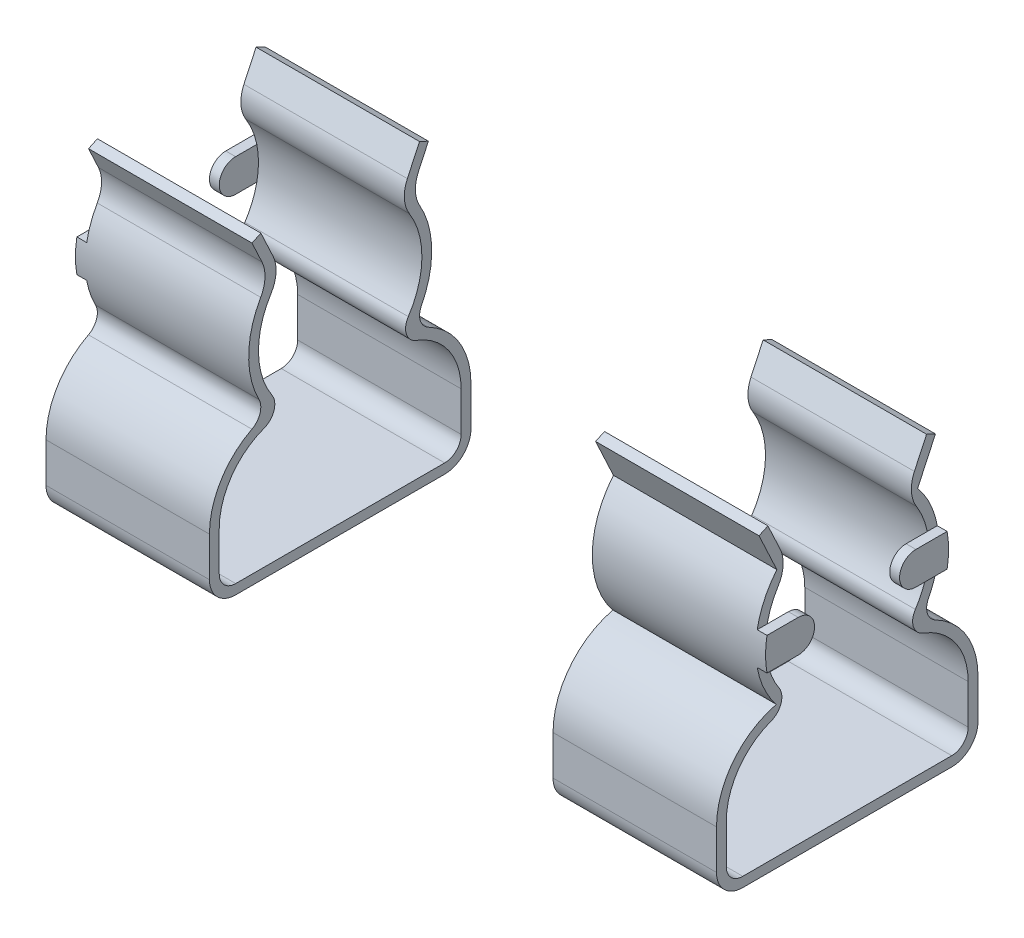
from build123d import *
from build123d.topology import SkipClean

# Parameters (mm, degrees)
CUT_EXTRUDE1_START       = -16.646
CUT_EXTRUDE1_OUTLINE_W   = 5.494349208
CUT_EXTRUDE1_OUTLINE_H   = 1.206951679
CUT_EXTRUDE1_DEPTH       = 22.78
CUT_EXTRUDE1_2_DEPTH     = 6.134
CUT_EXTRUDE1_3_DEPTH     = 6.134
CUT_EXTRUDE1_START_2     = -16.506
CUT_EXTRUDE1_4_DEPTH     = 0.001862507
CUT_EXTRUDE1_START_3     = 5.992137493
CUT_EXTRUDE1_5_DEPTH     = 0.001862507
CUT_EXTRUDE1_START_4     = -3.196
CUT_EXTRUDE1_6_OUTLINE_W = 0.14
CUT_EXTRUDE1_6_OUTLINE_H = 1.8
CUT_EXTRUDE1_6_DEPTH     = 6.392
CUT_EXTRUDE1_START_5     = -0.55
CUT_EXTRUDE1_7_DEPTH     = 1.1
CUT_EXTRUDE1_START_6     = -11.39
CUT_EXTRUDE1_8_DEPTH     = 22.78
SKETCH3_W                = 10.512
SKETCH3_H                = 1.206951679
CUT_EXTRUDE2_DEPTH       = 5.194349208
SKETCH4_W                = 10.512
SKETCH4_H                = 1.206951679
CUT_EXTRUDE3_DEPTH       = 0.3
CUT_EXTRUDE4_DEPTH       = 2.196
CUT_EXTRUDE5_DEPTH       = 2.196
CUT_EXTRUDE6_DEPTH       = 2.196
CUT_EXTRUDE7_DEPTH       = 2.196
CUT_EXTRUDE8_DEPTH       = 0.420665928
CUT_EXTRUDE9_DEPTH       = 0.420665928
CUT_EXTRUDE10_DEPTH      = 0.420665928
CUT_EXTRUDE11_DEPTH      = 0.420665928
BOSS_EXTRUDE7_DEPTH      = 1.291387254
BOSS_EXTRUDE8_DEPTH      = 1.291387254
BOSS_EXTRUDE9_DEPTH      = 1.291387254
BOSS_EXTRUDE10_DEPTH     = 1.291387254
CUT_EXTRUDE13_DEPTH      = 1.710951679
CUT_EXTRUDE14_DEPTH      = 1.710951679
CUT_EXTRUDE15_DEPTH      = 0.713334072
CUT_EXTRUDE16_DEPTH      = 0.713334072
BOSS_EXTRUDE13_DEPTH     = 0.3
BOSS_EXTRUDE14_DEPTH     = 0.3
BOSS_EXTRUDE15_DEPTH     = 0.3
BOSS_EXTRUDE16_DEPTH     = 0.3
DRAFT1_ANGLE             = -3.814074834
DRAFT2_START             = -1
DRAFT2_DEPTH             = 2
DRAFT2_START_2           = -0.55
DRAFT2_2_DEPTH           = 1.1
FILLET1_R                = 0.504
FILLET2_R                = 0.504
FILLET4_R                = 1
FILLET5_R                = 1
FILLET6_R                = 0.504
FILLET7_R                = 1
CUT_EXTRUDE21_START      = -6.1
SKETCH41_W               = 3
SKETCH41_H               = 2
CUT_EXTRUDE21_DEPTH      = 6.1


with BuildPart() as part:
    # Cut-Extrude1: read off the stored shape, not the designer's step
    # Cut-Extrude1 outline → Cut-Extrude1 (new body)
    with BuildSketch(Plane(origin=(5.256, 0, 0), x_dir=(0, 0, -1), z_dir=(1, 0, 0)).offset(CUT_EXTRUDE1_START)):
        with Locations((1.252825396, 3.20747584)):
            Rectangle(CUT_EXTRUDE1_OUTLINE_W, CUT_EXTRUDE1_OUTLINE_H)
    extrude(amount=CUT_EXTRUDE1_DEPTH)

    # Cut-Extrude1 2 outline → Cut-Extrude1 2 (add)
    with BuildSketch(Plane(origin=(5.256, 0, 0), x_dir=(0, 0, -1), z_dir=(1, 0, 0)).offset(CUT_EXTRUDE1_START)):
        with BuildLine():
            Line((3.7, 3.810951679), (4, 3.810951679))
            ThreePointArc((4, 3.810951679), (3.487694935, 5.293047436), (2.169493473, 6.142405557))
            ThreePointArc((2.169493473, 6.142405557), (2.799969455, 7.925596675), (2.152862757, 9.702820197))
            Line((2.152862757, 9.702820197), (1.880970421, 9.829605676))
            Line((1.880970421, 9.829605676), (1.797323966, 9.650225274))
            ThreePointArc((1.797323966, 9.650225274), (2.491845413, 7.710759639), (1.494349208, 5.908292355))
            ThreePointArc((1.494349208, 5.908292355), (3.047089033, 5.332770766), (3.7, 3.810951679))
        make_face()
        with BuildLine():
            ThreePointArc((3.196, 1.8), (3.764513852, 2.035486148), (4, 2.604))
            Line((4, 2.604), (-1.494349208, 2.604))
            Line((-1.494349208, 2.604), (-1.494349208, 3.810951679))
            Line((-1.494349208, 3.810951679), (-3.7, 3.810951679))
            ThreePointArc((-3.7, 3.810951679), (-3.047089033, 5.332770766), (-1.494349208, 5.908292355))
            ThreePointArc((-1.494349208, 5.908292355), (-2.491845413, 7.710759639), (-1.797323966, 9.650225274))
            Line((-1.797323966, 9.650225274), (-1.880970421, 9.829605676))
            Line((-1.880970421, 9.829605676), (-2.152862757, 9.702820197))
            ThreePointArc((-2.152862757, 9.702820197), (-2.799969455, 7.925596675), (-2.169493473, 6.142405557))
            ThreePointArc((-2.169493473, 6.142405557), (-3.487694935, 5.293047436), (-4, 3.810951679))
            Line((-4, 3.810951679), (-4, 2.604))
            ThreePointArc((-4, 2.604), (-3.764513852, 2.035486148), (-3.196, 1.8))
            Line((-3.196, 1.8), (3.196, 1.8))
        make_face()
    extrude(amount=CUT_EXTRUDE1_2_DEPTH)

    # Cut-Extrude1 3 outline → Cut-Extrude1 3 (add)
    with BuildSketch(Plane(origin=(5.256, 0, 0), x_dir=(0, 0, -1), z_dir=(1, 0, 0))):
        with BuildLine():
            Line((3.7, 3.810951679), (4, 3.810951679))
            ThreePointArc((4, 3.810951679), (3.487694935, 5.293047436), (2.169493473, 6.142405557))
            ThreePointArc((2.169493473, 6.142405557), (2.799969455, 7.925596675), (2.152862757, 9.702820197))
            Line((2.152862757, 9.702820197), (1.880970421, 9.829605676))
            Line((1.880970421, 9.829605676), (1.797323966, 9.650225274))
            ThreePointArc((1.797323966, 9.650225274), (2.491845413, 7.710759639), (1.494349208, 5.908292355))
            ThreePointArc((1.494349208, 5.908292355), (3.047089033, 5.332770766), (3.7, 3.810951679))
        make_face()
        with BuildLine():
            ThreePointArc((3.196, 1.8), (3.764513852, 2.035486148), (4, 2.604))
            Line((4, 2.604), (-1.494349208, 2.604))
            Line((-1.494349208, 2.604), (-1.494349208, 3.810951679))
            Line((-1.494349208, 3.810951679), (-3.7, 3.810951679))
            ThreePointArc((-3.7, 3.810951679), (-3.047089033, 5.332770766), (-1.494349208, 5.908292355))
            ThreePointArc((-1.494349208, 5.908292355), (-2.491845413, 7.710759639), (-1.797323966, 9.650225274))
            Line((-1.797323966, 9.650225274), (-1.880970421, 9.829605676))
            Line((-1.880970421, 9.829605676), (-2.152862757, 9.702820197))
            ThreePointArc((-2.152862757, 9.702820197), (-2.799969455, 7.925596675), (-2.169493473, 6.142405557))
            ThreePointArc((-2.169493473, 6.142405557), (-3.487694935, 5.293047436), (-4, 3.810951679))
            Line((-4, 3.810951679), (-4, 2.604))
            ThreePointArc((-4, 2.604), (-3.764513852, 2.035486148), (-3.196, 1.8))
            Line((-3.196, 1.8), (3.196, 1.8))
        make_face()
    extrude(amount=CUT_EXTRUDE1_3_DEPTH)

    # Cut-Extrude1 4 outline → Cut-Extrude1 4 (add)
    with BuildSketch(Plane(origin=(5.256, 0, 0), x_dir=(0, 0, -1), z_dir=(1, 0, 0)).offset(CUT_EXTRUDE1_START_2)):
        with BuildLine():
            Line((3.196, 0), (3.196, 1.8))
            Line((3.196, 1.8), (-3.196, 1.8))
            Line((-3.196, 1.8), (-3.196, 0))
            Line((-3.196, 0), (-0.55, 0))
            Line((-0.55, 0), (-0.55, -3.45))
            ThreePointArc((-0.55, -3.45), (-0.38890873, -3.83890873), (0, -4))
            ThreePointArc((0, -4), (0.38890873, -3.83890873), (0.55, -3.45))
            Line((0.55, -3.45), (0.55, 0))
            Line((0.55, 0), (3.196, 0))
        make_face()
    extrude(amount=CUT_EXTRUDE1_4_DEPTH)

    # Cut-Extrude1 5 outline → Cut-Extrude1 5 (add)
    with BuildSketch(Plane(origin=(5.256, 0, 0), x_dir=(0, 0, -1), z_dir=(1, 0, 0)).offset(CUT_EXTRUDE1_START_3)):
        with BuildLine():
            Line((3.196, 0), (3.196, 1.8))
            Line((3.196, 1.8), (-3.196, 1.8))
            Line((-3.196, 1.8), (-3.196, 0))
            Line((-3.196, 0), (-0.55, 0))
            Line((-0.55, 0), (-0.55, -3.45))
            ThreePointArc((-0.55, -3.45), (-0.38890873, -3.83890873), (0, -4))
            ThreePointArc((0, -4), (0.38890873, -3.83890873), (0.55, -3.45))
            Line((0.55, -3.45), (0.55, 0))
            Line((0.55, 0), (3.196, 0))
        make_face()
    extrude(amount=CUT_EXTRUDE1_5_DEPTH)

    # Cut-Extrude1 6 outline → Cut-Extrude1 6 (add)
    with BuildSketch(Plane.XY.offset(CUT_EXTRUDE1_START_4)):
        with Locations((-11.32, 0.9)):
            Rectangle(CUT_EXTRUDE1_6_OUTLINE_W, CUT_EXTRUDE1_6_OUTLINE_H)
        Polygon((-11.248137493, 1.8), (-11.248137493, 0), (-11.089334072, 0), (-10.969334072, 1.8), align=None)
        with Locations((11.32, 0.9)):
            Rectangle(CUT_EXTRUDE1_6_OUTLINE_W, CUT_EXTRUDE1_6_OUTLINE_H)
        Polygon((11.089334072, 0), (11.248137493, 0), (11.248137493, 1.8), (10.969334072, 1.8), align=None)
    extrude(amount=CUT_EXTRUDE1_6_DEPTH)

    # Cut-Extrude1 7 outline → Cut-Extrude1 7 (add)
    with BuildSketch(Plane.XY.offset(CUT_EXTRUDE1_START_5)):
        Polygon((-11.25, 0), (-11.39, 0), (-11.39, -3.253333333), (-11.25, -4), align=None)
        Polygon((-11.089334072, 0), (-11.248137493, 0), (-11.248137493, -2.38205131), align=None)
        Polygon((-11.248137493, -2.38205131), (-11.248137493, -3.99965078), (-10.955138344, -3.944713439), align=None)
        Polygon((11.25, -4), (11.39, -3.253333333), (11.39, 0), (11.25, 0), align=None)
        Polygon((10.955138344, -3.944713439), (11.248137493, -3.99965078), (11.248137493, -2.38205131), align=None)
        Polygon((11.248137493, -2.38205131), (11.248137493, 0), (11.089334072, 0), align=None)
    extrude(amount=CUT_EXTRUDE1_7_DEPTH)

    # Cut-Extrude1 8 outline → Cut-Extrude1 8 (cut)
    with SkipClean():  # the faces are left unmerged after this step: merging them gives an invalid solid
        with BuildSketch(Plane.YZ.offset(CUT_EXTRUDE1_START_6)):
            with BuildLine():
                ThreePointArc((-4, 0), (-3.83890873, 0.38890873), (-3.45, 0.55))
                Line((-3.45, 0.55), (-2, 0.55))
                Line((-2, 0.55), (-2, 2))
                Line((-2, 2), (-5, 2))
                Line((-5, 2), (-5, -2))
                Line((-5, -2), (-2, -2))
                Line((-2, -2), (-2, -0.55))
                Line((-2, -0.55), (-3.45, -0.55))
                ThreePointArc((-3.45, -0.55), (-3.83890873, -0.38890873), (-4, 0))
            make_face()
        extrude(amount=CUT_EXTRUDE1_8_DEPTH, mode=Mode.SUBTRACT)

    # Sketch3 → Cut-Extrude2 (cut)
    with SkipClean():  # the faces are left unmerged after this step: merging them gives an invalid solid
        with BuildSketch(Plane.XY.offset(1.494349208)):
            with Locations((0, 3.20747584)):
                Rectangle(SKETCH3_W, SKETCH3_H)
        extrude(amount=-CUT_EXTRUDE2_DEPTH, mode=Mode.SUBTRACT)

    # Sketch4 → Cut-Extrude3 (cut)
    with SkipClean():  # the faces are left unmerged after this step: merging them gives an invalid solid
        with BuildSketch(Plane.XY.offset(-3.7)):
            with Locations((0, 3.20747584)):
                Rectangle(SKETCH4_W, SKETCH4_H)
        extrude(amount=-CUT_EXTRUDE3_DEPTH, mode=Mode.SUBTRACT)


with BuildPart() as cut_extrude3_piece_1:
    # of the separate pieces the step leaves, piece 1, a body of its own (cut_extrude3_pieces)
    add(part.part.solids().sort_by_distance((-11.39, 2.604, -4))[0])

    # Sketch5 → Cut-Extrude4 (cut)
    with BuildSketch(Plane(origin=(0, 0, -3.196), x_dir=(-1, 0, 0), z_dir=(0, 0, -1))):
        Polygon((11.39, 1.8), (10.969334072, 1.8), (11.089334072, 0), (11.39, 0), align=None)
    extrude(amount=-CUT_EXTRUDE4_DEPTH, mode=Mode.SUBTRACT)

    # Sketch8 → Cut-Extrude7 (cut)
    with SkipClean():  # the faces are left unmerged after this step: merging them gives an invalid solid
        with BuildSketch(Plane.XY.offset(3.196)):
            Polygon((-11.089334072, 0), (-10.969334072, 1.8), (-11.39, 1.8), (-11.39, 0), align=None)
        extrude(amount=-CUT_EXTRUDE7_DEPTH, mode=Mode.SUBTRACT)

    # Sketch10 → Cut-Extrude9 (cut)
    with SkipClean():  # the faces are left unmerged after this step: merging them gives an invalid solid
        with BuildSketch(Plane.ZY.offset(11.39)):
            with BuildLine():
                Line((-4.8, 2.604), (-4, 2.604))
                ThreePointArc((-4, 2.604), (-3.764513852, 2.035486148), (-3.196, 1.8))
                Line((-3.196, 1.8), (-1, 1.8))
                Line((-1, 1.8), (-1, 2.1))
                add(Edge.make_bspline(
                    [(-1, 3.810951679), (-1, 3.240634453), (-1, 2.670317226), (-1, 2.1)],
                    knots=[0, 0, 0, 0, 1, 1, 1, 1], degree=3))
                Line((-1, 3.810951679), (-3.7, 3.810951679))
                ThreePointArc((-3.7, 3.810951679), (-3.047089033, 5.332770766), (-1.494349208, 5.908292355))
                ThreePointArc((-1.494349208, 5.908292355), (-2.491845413, 7.710759639), (-1.797323966, 9.650225274))
                Line((-1.797323966, 9.650225274), (-1.880970421, 9.829605676))
                Line((-1.880970421, 9.829605676), (-2.152862757, 9.702820197))
                ThreePointArc((-2.152862757, 9.702820197), (-2.799969455, 7.925596675), (-2.169493473, 6.142405557))
                ThreePointArc((-2.169493473, 6.142405557), (-3.487694935, 5.293047436), (-4, 3.810951679))
                Line((-4, 3.810951679), (-4.8, 3.810951679))
                Line((-4.8, 3.810951679), (-4.8, 2.604))
            make_face()
        extrude(amount=-CUT_EXTRUDE9_DEPTH, mode=Mode.SUBTRACT)

    # Sketch12 → Cut-Extrude11 (cut)
    with SkipClean():  # the faces are left unmerged after this step: merging them gives an invalid solid
        with BuildSketch(Plane.ZY.offset(11.39)):
            with BuildLine():
                Line((1, 1.8), (3.196, 1.8))
                ThreePointArc((3.196, 1.8), (3.764513852, 2.035486148), (4, 2.604))
                Line((4, 2.604), (4, 3.810951679))
                ThreePointArc((4, 3.810951679), (3.487694935, 5.293047436), (2.169493473, 6.142405557))
                ThreePointArc((2.169493473, 6.142405557), (2.799969455, 7.925596675), (2.152862757, 9.702820197))
                Line((2.152862757, 9.702820197), (1.880970421, 9.829605676))
                Line((1.880970421, 9.829605676), (1.797323966, 9.650225274))
                ThreePointArc((1.797323966, 9.650225274), (2.491845413, 7.710759639), (1.494349208, 5.908292355))
                ThreePointArc((1.494349208, 5.908292355), (3.047089033, 5.332770766), (3.7, 3.810951679))
                Line((3.7, 3.810951679), (1, 3.810951679))
                add(Edge.make_bspline(
                    [(1, 3.810951679), (1, 3.240634453), (1, 2.670317226), (1, 2.1)],
                    knots=[0, 0, 0, 0, 1, 1, 1, 1], degree=3))
                Line((1, 2.1), (1, 1.8))
            make_face()
        extrude(amount=-CUT_EXTRUDE11_DEPTH, mode=Mode.SUBTRACT)

    # Sketch21 → Boss-Extrude9 (add)
    with SkipClean():  # the faces are left unmerged after this step: merging them gives an invalid solid
        with BuildSketch(Plane(origin=(0, 8.794430675, -4.100910373), x_dir=(-1, 0, 0), z_dir=(0, 0.9063077870366588, -0.4226182617406808))):
            with BuildLine():
                Line((5.256, 2.149432725), (5.256, 2.449432725))
                Line((5.256, 2.449432725), (10.256, 2.449432725))
                add(Edge.make_bspline(
                    [(10.969334072, 2.449432725), (10.731556048, 2.449432725), (10.493778024, 2.449432725), (10.256, 2.449432725)],
                    knots=[0, 0, 0, 0, 1, 1, 1, 1], degree=3))
                Line((10.969334072, 2.449432725), (10.969334072, 2.149432725))
                add(Edge.make_bspline(
                    [(10.969334072, 2.149432725), (10.731556048, 2.149432725), (10.493778024, 2.149432725), (10.256, 2.149432725)],
                    knots=[0, 0, 0, 0, 1, 1, 1, 1], degree=3))
                Line((10.256, 2.149432725), (5.256, 2.149432725))
            make_face()
        extrude(amount=BOSS_EXTRUDE9_DEPTH)

    # Sketch22 → Boss-Extrude10 (add)
    with SkipClean():  # the faces are left unmerged after this step: merging them gives an invalid solid
        with BuildSketch(Plane(origin=(0, 8.794430675, 4.100910373), x_dir=(-1, 0, 0), z_dir=(0, 0.9063077870366588, 0.4226182617406808))):
            with BuildLine():
                Line((5.256, -2.449432725), (5.256, -2.149432725))
                Line((5.256, -2.149432725), (10.256, -2.149432725))
                add(Edge.make_bspline(
                    [(10.969334072, -2.149432725), (10.731556048, -2.149432725), (10.493778024, -2.149432725), (10.256, -2.149432725)],
                    knots=[0, 0, 0, 0, 1, 1, 1, 1], degree=3))
                Line((10.969334072, -2.149432725), (10.969334072, -2.449432725))
                add(Edge.make_bspline(
                    [(10.969334072, -2.449432725), (10.731556048, -2.449432725), (10.493778024, -2.449432725), (10.256, -2.449432725)],
                    knots=[0, 0, 0, 0, 1, 1, 1, 1], degree=3))
                Line((10.256, -2.449432725), (5.256, -2.449432725))
            make_face()
        extrude(amount=BOSS_EXTRUDE10_DEPTH)

    # Sketch24 → Cut-Extrude13 (cut)
    with SkipClean():  # the faces are left unmerged after this step: merging them gives an invalid solid
        with BuildSketch(Plane(origin=(0, 3.810951679, 0), x_dir=(-1, 0, 0), z_dir=(0, 1, 0))):
            Polygon((10.969334072, -3.7), (10.969334072, -1), (11.39, -1), (11.39, 1), (10.969334072, 1), (10.969334072, 3.7), (5.256, 3.7), (5.256, -3.7), align=None)
        extrude(amount=-CUT_EXTRUDE13_DEPTH, mode=Mode.SUBTRACT)

    # Sketch27 → Cut-Extrude16 (cut)
    with SkipClean():  # the faces are left unmerged after this step: merging them gives an invalid solid
        with BuildSketch(Plane.ZY.offset(10.969334072)):
            with BuildLine():
                Line((-1, 2.1), (-3.7, 2.1))
                Line((-3.7, 2.1), (-3.7, 3.810951679))
                ThreePointArc((-3.7, 3.810951679), (-3.047089033, 5.332770766), (-1.494349208, 5.908292355))
                ThreePointArc((-1.494349208, 5.908292355), (-2.491845413, 7.710759639), (-1.797323966, 9.650225274))
                Line((-1.797323966, 9.650225274), (-2.426734257, 11))
                Line((-2.426734257, 11), (-2.698626593, 10.873214521))
                Line((-2.698626593, 10.873214521), (-2.152862757, 9.702820197))
                ThreePointArc((-2.152862757, 9.702820197), (-2.799969455, 7.925596675), (-2.169493473, 6.142405557))
                ThreePointArc((-2.169493473, 6.142405557), (-3.487694935, 5.293047436), (-4, 3.810951679))
                Line((-4, 3.810951679), (-4, 2.604))
                ThreePointArc((-4, 2.604), (-3.764513852, 2.035486148), (-3.196, 1.8))
                Line((-3.196, 1.8), (-4, 1.8))
                Line((-4, 1.8), (-4, 0))
                Line((-4, 0), (4, 0))
                Line((4, 0), (4, 1.8))
                Line((4, 1.8), (3.196, 1.8))
                ThreePointArc((3.196, 1.8), (3.764513852, 2.035486148), (4, 2.604))
                Line((4, 2.604), (4, 3.810951679))
                ThreePointArc((4, 3.810951679), (3.487694935, 5.293047436), (2.169493473, 6.142405557))
                ThreePointArc((2.169493473, 6.142405557), (2.799969455, 7.925596675), (2.152862757, 9.702820197))
                Line((2.152862757, 9.702820197), (2.698626593, 10.873214521))
                Line((2.698626593, 10.873214521), (2.426734257, 11))
                Line((2.426734257, 11), (1.797323966, 9.650225274))
                ThreePointArc((1.797323966, 9.650225274), (2.491845413, 7.710759639), (1.494349208, 5.908292355))
                ThreePointArc((1.494349208, 5.908292355), (3.047089033, 5.332770766), (3.7, 3.810951679))
                Line((3.7, 3.810951679), (3.7, 2.1))
                Line((3.7, 2.1), (1, 2.1))
                Line((1, 2.1), (1, 1.8))
                Line((1, 1.8), (-1, 1.8))
                Line((-1, 1.8), (-1, 2.1))
            make_face()
        extrude(amount=-CUT_EXTRUDE16_DEPTH, mode=Mode.SUBTRACT)

    # Sketch29 → Boss-Extrude13 (add)
    with SkipClean():  # the faces are left unmerged after this step: merging them gives an invalid solid
        with BuildSketch(Plane.ZY.offset(10.256)):
            with BuildLine():
                Line((1.8, 8.412518002), (2.754995463, 8.412518002))
                ThreePointArc((2.754995463, 8.412518002), (2.8, 7.912518002), (2.754995463, 7.412518002))
                Line((2.754995463, 7.412518002), (1.8, 7.412518002))
                ThreePointArc((1.8, 7.412518002), (1.3, 7.912518002), (1.8, 8.412518002))
            make_face()
        extrude(amount=BOSS_EXTRUDE13_DEPTH)

    # Sketch30 → Boss-Extrude14 (add)
    with SkipClean():  # the faces are left unmerged after this step: merging them gives an invalid solid
        with BuildSketch(Plane.ZY.offset(10.256)):
            with BuildLine():
                Line((-1.8, 7.412518002), (-2.754995463, 7.412518002))
                ThreePointArc((-2.754995463, 7.412518002), (-2.8, 7.912518002), (-2.754995463, 8.412518002))
                Line((-2.754995463, 8.412518002), (-1.8, 8.412518002))
                ThreePointArc((-1.8, 8.412518002), (-1.3, 7.912518002), (-1.8, 7.412518002))
            make_face()
        extrude(amount=BOSS_EXTRUDE14_DEPTH)

    # Draft2: read off the stored shape, not the designer's step
    # Draft2 outline → Draft2 (cut)
    with SkipClean():  # the faces are left unmerged after this step: merging them gives an invalid solid
        with BuildSketch(Plane.XY.offset(DRAFT2_START)):
            Polygon((-11.39, 0), (-11.25, 2.1), (-11.39, 2.1), align=None)
        extrude(amount=DRAFT2_DEPTH, mode=Mode.SUBTRACT)

    # Draft2 2 outline → Draft2 2 (add)
    with SkipClean():  # the faces are left unmerged after this step: merging them gives an invalid solid
        with BuildSketch(Plane.XY.offset(DRAFT2_START_2)):
            Polygon((-11.39, -3.253333333), (-11.39, 0), (-11.55, -2.4), align=None)
        extrude(amount=DRAFT2_2_DEPTH)

    # Fillet4
    fillet4_edges = [cut_extrude3_piece_1.edges().sort_by_distance(p)[0] for p in [
        (-7.756, 9.702820197, 2.152862757),
        (-7.756, 9.702820197, -2.152862757),
    ]]
    fillet(fillet4_edges, radius=FILLET4_R)

    # Fillet6
    fillet6_edges = [cut_extrude3_piece_1.edges().sort_by_distance(p)[0] for p in [
        (-7.756, 2.1, -3.7),
        (-7.756, 6.142405557, -2.169493473),
        (-7.756, 5.908292355, 1.494349208),
        (-7.756, 2.1, 3.7),
        (-7.756, 5.908292355, -1.494349208),
        (-7.756, 6.142405557, 2.169493473),
    ]]
    fillet(fillet6_edges, radius=FILLET6_R)

    # Fillet7
    # the kernel refuses this fillet: 1 mm, written as the material it takes off along each edge
    with BuildSketch(Plane(origin=(-11.77707261, 9.650225274, -1.797323966), x_dir=(0, 0.9063077873763193, -0.4226182610122761), z_dir=(1, 0, 0))) as fillet7_piece_1:
        with BuildLine():
            CenterArc((0.608429044, -1), FILLET7_R, 90, 57.227978654)
            ThreePointArc((-0.232401986, -0.458702319), (-0.10437603, -0.235342289), (0, 0))
            Line((0, 0), (0.608429044, 0))
        make_face()
    extrude(amount=8.042145219, mode=Mode.SUBTRACT)
    with BuildSketch(Plane(origin=(-11.77707261, 9.650225274, 1.797323966), x_dir=(0, 0.9063077873763193, 0.42261826101227634), z_dir=(1, 0, 0))) as fillet7_piece_2:
        with BuildLine():
            CenterArc((0.608429044, 1), FILLET7_R, 212.772021346, 57.227978654)
            ThreePointArc((-0.232401986, 0.458702319), (-0.10437603, 0.235342289), (0, 0))
            Line((0, 0), (0.608429044, 0))
        make_face()
    extrude(amount=8.042145219, mode=Mode.SUBTRACT)


with BuildPart() as cut_extrude3_piece_2:
    # of the separate pieces the step leaves, piece 2, a body of its own (cut_extrude3_pieces)
    add(part.part.solids().sort_by_distance((5.256, 2.604, -4))[0])

    # Sketch6 → Cut-Extrude5 (cut)
    with BuildSketch(Plane(origin=(0, 0, -3.196), x_dir=(-1, 0, 0), z_dir=(0, 0, -1))):
        Polygon((-11.089334072, 0), (-10.969334072, 1.8), (-11.39, 1.8), (-11.39, 0), align=None)
    extrude(amount=-CUT_EXTRUDE5_DEPTH, mode=Mode.SUBTRACT)

    # Sketch7 → Cut-Extrude6 (cut)
    with BuildSketch(Plane.XY.offset(3.196)):
        Polygon((11.39, 1.8), (10.969334072, 1.8), (11.089334072, 0), (11.39, 0), align=None)
    extrude(amount=-CUT_EXTRUDE6_DEPTH, mode=Mode.SUBTRACT)

    # Sketch9 → Cut-Extrude8 (cut)
    with BuildSketch(Plane(origin=(11.39, 0, 0), x_dir=(0, 0, -1), z_dir=(1, 0, 0))):
        with BuildLine():
            Line((4, 2.604), (4.8, 2.604))
            Line((4.8, 2.604), (4.8, 3.810951679))
            Line((4.8, 3.810951679), (4, 3.810951679))
            ThreePointArc((4, 3.810951679), (3.487694935, 5.293047436), (2.169493473, 6.142405557))
            ThreePointArc((2.169493473, 6.142405557), (2.799969455, 7.925596675), (2.152862757, 9.702820197))
            Line((2.152862757, 9.702820197), (1.880970421, 9.829605676))
            Line((1.880970421, 9.829605676), (1.797323966, 9.650225274))
            ThreePointArc((1.797323966, 9.650225274), (2.491845413, 7.710759639), (1.494349208, 5.908292355))
            ThreePointArc((1.494349208, 5.908292355), (3.047089033, 5.332770766), (3.7, 3.810951679))
            Line((3.7, 3.810951679), (1, 3.810951679))
            add(Edge.make_bspline(
                [(1, 3.810951679), (1, 3.240634453), (1, 2.670317226), (1, 2.1)],
                knots=[0, 0, 0, 0, 1, 1, 1, 1], degree=3))
            Line((1, 2.1), (1, 1.8))
            Line((1, 1.8), (3.196, 1.8))
            ThreePointArc((3.196, 1.8), (3.764513852, 2.035486148), (4, 2.604))
        make_face()
    extrude(amount=-CUT_EXTRUDE8_DEPTH, mode=Mode.SUBTRACT)

    # Sketch11 → Cut-Extrude10 (cut)
    with BuildSketch(Plane(origin=(11.39, 0, 0), x_dir=(0, 0, -1), z_dir=(1, 0, 0))):
        with BuildLine():
            Line((-3.196, 1.8), (-1, 1.8))
            Line((-1, 1.8), (-1, 2.1))
            add(Edge.make_bspline(
                [(-1, 3.810951679), (-1, 3.240634453), (-1, 2.670317226), (-1, 2.1)],
                knots=[0, 0, 0, 0, 1, 1, 1, 1], degree=3))
            Line((-1, 3.810951679), (-3.7, 3.810951679))
            ThreePointArc((-3.7, 3.810951679), (-3.047089033, 5.332770766), (-1.494349208, 5.908292355))
            ThreePointArc((-1.494349208, 5.908292355), (-2.491845413, 7.710759639), (-1.797323966, 9.650225274))
            Line((-1.797323966, 9.650225274), (-1.880970421, 9.829605676))
            Line((-1.880970421, 9.829605676), (-2.152862757, 9.702820197))
            ThreePointArc((-2.152862757, 9.702820197), (-2.799969455, 7.925596675), (-2.169493473, 6.142405557))
            ThreePointArc((-2.169493473, 6.142405557), (-3.487694935, 5.293047436), (-4, 3.810951679))
            Line((-4, 3.810951679), (-4, 2.604))
            ThreePointArc((-4, 2.604), (-3.764513852, 2.035486148), (-3.196, 1.8))
        make_face()
    extrude(amount=-CUT_EXTRUDE10_DEPTH, mode=Mode.SUBTRACT)

    # Sketch19 → Boss-Extrude7 (add)
    with BuildSketch(Plane(origin=(0, 8.794430675, 4.100910373), x_dir=(-1, 0, 0), z_dir=(0, 0.9063077870366588, 0.4226182617406808))):
        with BuildLine():
            Line((-5.256, -2.149432725), (-5.256, -2.449432725))
            Line((-5.256, -2.449432725), (-10.256, -2.449432725))
            add(Edge.make_bspline(
                [(-10.969334072, -2.449432725), (-10.731556048, -2.449432725), (-10.493778024, -2.449432725), (-10.256, -2.449432725)],
                knots=[0, 0, 0, 0, 1, 1, 1, 1], degree=3))
            Line((-10.969334072, -2.449432725), (-10.969334072, -2.149432725))
            add(Edge.make_bspline(
                [(-10.969334072, -2.149432725), (-10.731556048, -2.149432725), (-10.493778024, -2.149432725), (-10.256, -2.149432725)],
                knots=[0, 0, 0, 0, 1, 1, 1, 1], degree=3))
            Line((-10.256, -2.149432725), (-5.256, -2.149432725))
        make_face()
    extrude(amount=BOSS_EXTRUDE7_DEPTH)

    # Sketch20 → Boss-Extrude8 (add)
    with BuildSketch(Plane(origin=(0, 8.794430675, -4.100910373), x_dir=(-1, 0, 0), z_dir=(0, 0.9063077870366588, -0.4226182617406808))):
        with BuildLine():
            Line((-5.256, 2.449432725), (-5.256, 2.149432725))
            Line((-5.256, 2.149432725), (-10.256, 2.149432725))
            add(Edge.make_bspline(
                [(-10.969334072, 2.149432725), (-10.731556048, 2.149432725), (-10.493778024, 2.149432725), (-10.256, 2.149432725)],
                knots=[0, 0, 0, 0, 1, 1, 1, 1], degree=3))
            Line((-10.969334072, 2.149432725), (-10.969334072, 2.449432725))
            add(Edge.make_bspline(
                [(-10.969334072, 2.449432725), (-10.731556048, 2.449432725), (-10.493778024, 2.449432725), (-10.256, 2.449432725)],
                knots=[0, 0, 0, 0, 1, 1, 1, 1], degree=3))
            Line((-10.256, 2.449432725), (-5.256, 2.449432725))
        make_face()
    extrude(amount=BOSS_EXTRUDE8_DEPTH)

    # Sketch25 → Cut-Extrude14 (cut)
    with BuildSketch(Plane(origin=(0, 3.810951679, 0), x_dir=(-1, 0, 0), z_dir=(0, 1, 0))):
        Polygon((-10.969334072, 3.7), (-10.969334072, 1), (-11.39, 1), (-11.39, -1), (-10.969334072, -1), (-10.969334072, -3.7), (-5.256, -3.7), (-5.256, 3.7), align=None)
    extrude(amount=-CUT_EXTRUDE14_DEPTH, mode=Mode.SUBTRACT)

    # Sketch26 → Cut-Extrude15 (cut)
    with BuildSketch(Plane(origin=(10.969334072, 0, 0), x_dir=(0, 0, -1), z_dir=(1, 0, 0))):
        with BuildLine():
            Line((-1, 1.8), (-1, 2.1))
            Line((-1, 2.1), (-3.7, 2.1))
            Line((-3.7, 2.1), (-3.7, 3.810951679))
            ThreePointArc((-3.7, 3.810951679), (-3.047089033, 5.332770766), (-1.494349208, 5.908292355))
            ThreePointArc((-1.494349208, 5.908292355), (-2.491845413, 7.710759639), (-1.797323966, 9.650225274))
            Line((-1.797323966, 9.650225274), (-2.426734257, 11))
            Line((-2.426734257, 11), (-2.698626593, 10.873214521))
            Line((-2.698626593, 10.873214521), (-2.152862757, 9.702820197))
            ThreePointArc((-2.152862757, 9.702820197), (-2.799969455, 7.925596675), (-2.169493473, 6.142405557))
            ThreePointArc((-2.169493473, 6.142405557), (-3.487694935, 5.293047436), (-4, 3.810951679))
            Line((-4, 3.810951679), (-4, 2.604))
            ThreePointArc((-4, 2.604), (-3.764513852, 2.035486148), (-3.196, 1.8))
            Line((-3.196, 1.8), (-4, 1.8))
            Line((-4, 1.8), (-4, 0))
            Line((-4, 0), (4, 0))
            Line((4, 0), (4, 1.8))
            Line((4, 1.8), (3.196, 1.8))
            ThreePointArc((3.196, 1.8), (3.764513852, 2.035486148), (4, 2.604))
            Line((4, 2.604), (4, 3.810951679))
            ThreePointArc((4, 3.810951679), (3.487694935, 5.293047436), (2.169493473, 6.142405557))
            ThreePointArc((2.169493473, 6.142405557), (2.799969455, 7.925596675), (2.152862757, 9.702820197))
            Line((2.152862757, 9.702820197), (2.698626593, 10.873214521))
            Line((2.698626593, 10.873214521), (2.426734257, 11))
            Line((2.426734257, 11), (1.797323966, 9.650225274))
            ThreePointArc((1.797323966, 9.650225274), (2.491845413, 7.710759639), (1.494349208, 5.908292355))
            ThreePointArc((1.494349208, 5.908292355), (3.047089033, 5.332770766), (3.7, 3.810951679))
            Line((3.7, 3.810951679), (3.7, 2.1))
            Line((3.7, 2.1), (1, 2.1))
            Line((1, 2.1), (1, 1.8))
            Line((1, 1.8), (-1, 1.8))
        make_face()
    extrude(amount=-CUT_EXTRUDE15_DEPTH, mode=Mode.SUBTRACT)

    # Sketch31 → Boss-Extrude15 (add)
    with BuildSketch(Plane(origin=(10.256, 0, 0), x_dir=(0, 0, -1), z_dir=(1, 0, 0))):
        with BuildLine():
            Line((1.8, 8.412518002), (2.754995463, 8.412518002))
            ThreePointArc((2.754995463, 8.412518002), (2.8, 7.912518002), (2.754995463, 7.412518002))
            Line((2.754995463, 7.412518002), (1.8, 7.412518002))
            ThreePointArc((1.8, 7.412518002), (1.3, 7.912518002), (1.8, 8.412518002))
        make_face()
    extrude(amount=BOSS_EXTRUDE15_DEPTH)

    # Sketch32 → Boss-Extrude16 (add)
    with BuildSketch(Plane(origin=(10.256, 0, 0), x_dir=(0, 0, -1), z_dir=(1, 0, 0))):
        with BuildLine():
            Line((-1.8, 7.412518002), (-2.754995463, 7.412518002))
            ThreePointArc((-2.754995463, 7.412518002), (-2.8, 7.912518002), (-2.754995463, 8.412518002))
            Line((-2.754995463, 8.412518002), (-1.8, 8.412518002))
            ThreePointArc((-1.8, 8.412518002), (-1.3, 7.912518002), (-1.8, 7.412518002))
        make_face()
    extrude(amount=BOSS_EXTRUDE16_DEPTH)

    # Draft1
    draft1_faces = [cut_extrude3_piece_2.faces().sort_by_distance(p)[0] for p in [
        (11.39, -0.181431836, 0),
    ]]
    draft(draft1_faces, Plane(origin=(11.55, 0, -1), x_dir=(0, 0, -1), z_dir=(0, -1, 0)), DRAFT1_ANGLE)

    # Fillet1
    fillet1_edges = [cut_extrude3_piece_2.edges().sort_by_distance(p)[0] for p in [
        (7.756, 6.142405557, -2.169493473),
    ]]
    fillet(fillet1_edges, radius=FILLET1_R)

    # Fillet2
    fillet2_edges = [cut_extrude3_piece_2.edges().sort_by_distance(p)[0] for p in [
        (7.756, 5.908292355, 1.494349208),
        (7.756, 2.1, 3.7),
        (7.756, 2.1, -3.7),
        (7.756, 5.908292355, -1.494349208),
    ]]
    fillet(fillet2_edges, radius=FILLET2_R)

    # Fillet5
    fillet5_edges = [cut_extrude3_piece_2.edges().sort_by_distance(p)[0] for p in [
        (7.756, 9.650225274, 1.797323966),
        (7.756, 9.650225274, -1.797323966),
    ]]
    fillet(fillet5_edges, radius=FILLET5_R)


with BuildPart() as cut_extrude21_tool:
    # Sketch41 → Cut-Extrude21 (new body)
    with BuildSketch(Plane(origin=(0, 2.1, 0), x_dir=(1, 0, 0), z_dir=(0, 1, 0)).offset(CUT_EXTRUDE21_START)):
        with Locations((-11.756, 0)):
            Rectangle(SKETCH41_W, SKETCH41_H)
        with Locations((11.756, 0)):
            Rectangle(SKETCH41_W, SKETCH41_H)
    extrude(amount=CUT_EXTRUDE21_DEPTH)


with BuildPart() as cut_extrude3_piece_1_1:
    add(cut_extrude3_piece_1.part)

    # Cut-Extrude21: cut by cut_extrude21_tool
    add(cut_extrude21_tool.part, mode=Mode.SUBTRACT)


with BuildPart() as cut_extrude3_piece_2_1:
    add(cut_extrude3_piece_2.part)

    # Cut-Extrude21: cut by cut_extrude21_tool
    add(cut_extrude21_tool.part, mode=Mode.SUBTRACT)


solid = Compound([cut_extrude3_piece_1_1.part, cut_extrude3_piece_2_1.part])
